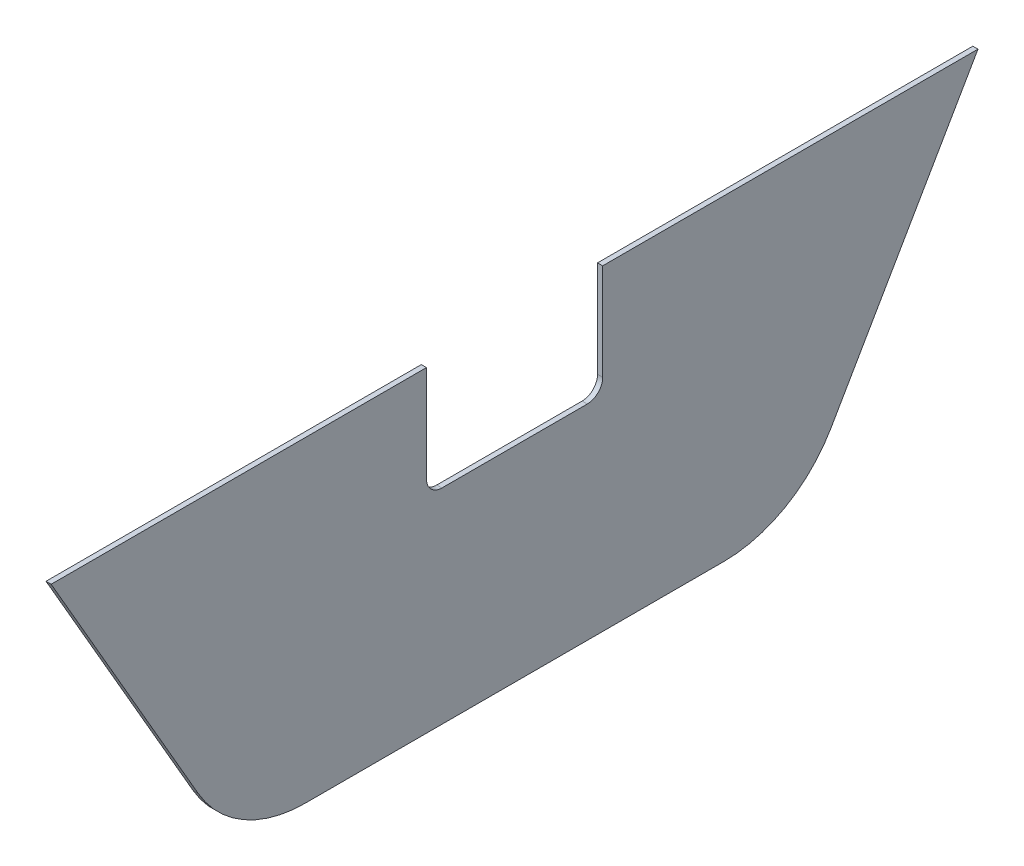
from build123d import *

# Parameters (mm, degrees)
BOSS_EXTRUDE1_DEPTH = 2


with BuildPart() as part:
    # Sketch3 → Boss-Extrude1 (new body)
    with BuildSketch(Plane(origin=(0, 0, 0), x_dir=(0, 0, -1), z_dir=(1, 0, 0))):
        with BuildLine():
            Line((-58.824606693, -414.80652233), (-1.666930044, -513.80652233))
            ThreePointArc((-1.666930044, -513.80652233), (15.902289338, -531.375741711), (39.902289338, -537.80652233))
            Line((39.902289338, -537.80652233), (202.448497275, -537.80652233))
            ThreePointArc((202.448497275, -537.80652233), (226.448497275, -531.375741711), (244.017716657, -513.80652233))
            Line((244.017716657, -513.80652233), (301.175393307, -414.80652233))
            Line((301.175393307, -414.80652233), (155.400393307, -414.80652233))
            Line((155.400393307, -414.80652233), (155.400393307, -452.30652233))
            ThreePointArc((155.400393307, -452.30652233), (153.643033994, -456.549163017), (149.400393307, -458.30652233))
            Line((149.400393307, -458.30652233), (92.950393307, -458.30652233))
            ThreePointArc((92.950393307, -458.30652233), (88.70775262, -456.549163017), (86.950393307, -452.30652233))
            Line((86.950393307, -452.30652233), (86.950393307, -414.80652233))
            Line((86.950393307, -414.80652233), (-58.824606693, -414.80652233))
        make_face()
    extrude(amount=BOSS_EXTRUDE1_DEPTH)


solid = part.part
